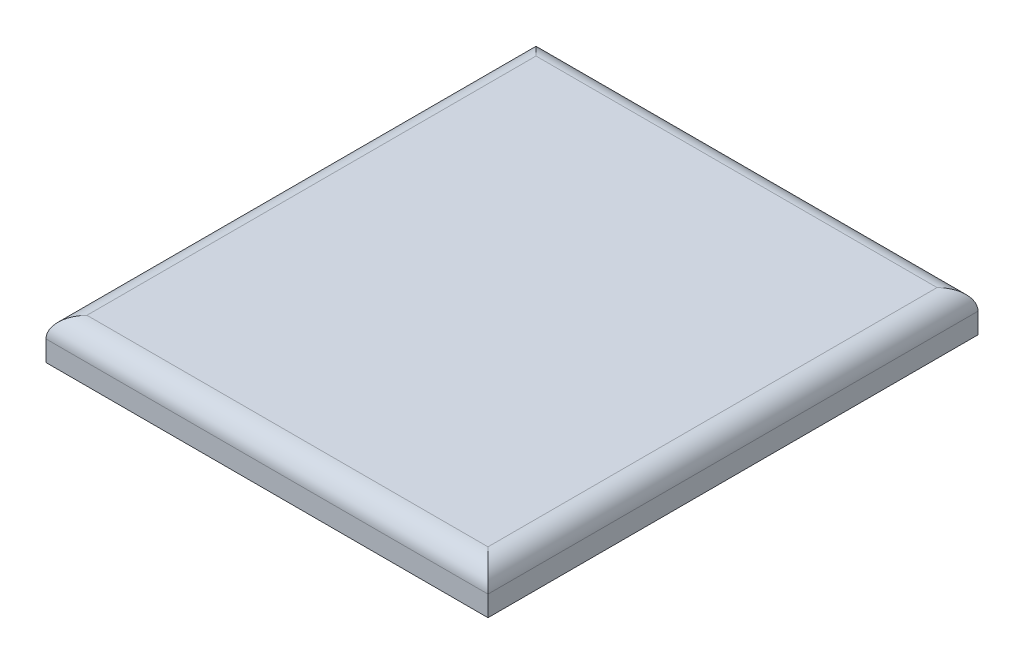
from build123d import *

# Parameters (mm, degrees)
SKETCH1_W           = 431.8
SKETCH1_H           = 478.71644455
BOSS_EXTRUDE1_DEPTH = 40
FILLET1_START       = -215.9
FILLET1_DEPTH       = 431.8
FILLET1_START_2     = -240
FILLET1_2_DEPTH     = 480


with BuildPart() as part:
    # Sketch1 → Boss-Extrude1 (new body)
    with BuildSketch(Plane(origin=(0, 0, 0), x_dir=(1, 0, 0), z_dir=(0, 1, 0))):
        Rectangle(SKETCH1_W, SKETCH1_H)
    extrude(amount=BOSS_EXTRUDE1_DEPTH)

    # Fillet1: read off the stored shape, not the designer's step
    # Fillet1 outline → Fillet1 (cut)
    with BuildSketch(Plane.YZ.offset(FILLET1_START)):
        with BuildLine():
            Line((40, -239.358222275), (40, -219.358222275))
            ThreePointArc((40, -219.358222275), (34.142135624, -233.500357899), (20, -239.358222275))
            Line((20, -239.358222275), (40, -239.358222275))
        make_face()
        with BuildLine():
            ThreePointArc((20, 239.358222275), (34.142135624, 233.500357899), (40, 219.358222275))
            Line((40, 219.358222275), (40, 239.358222275))
            Line((40, 239.358222275), (20, 239.358222275))
        make_face()
    extrude(amount=FILLET1_DEPTH, mode=Mode.SUBTRACT)

    # Fillet1 2 outline → Fillet1 2 (cut)
    with BuildSketch(Plane.XY.offset(FILLET1_START_2)):
        with BuildLine():
            Line((215.9, 40), (195.9, 40))
            ThreePointArc((195.9, 40), (210.042135624, 34.142135624), (215.9, 20))
            Line((215.9, 20), (215.9, 40))
        make_face()
        with BuildLine():
            ThreePointArc((-215.9, 20), (-210.042135624, 34.142135624), (-195.9, 40))
            Line((-195.9, 40), (-215.9, 40))
            Line((-215.9, 40), (-215.9, 20))
        make_face()
    extrude(amount=FILLET1_2_DEPTH, mode=Mode.SUBTRACT)


solid = part.part
